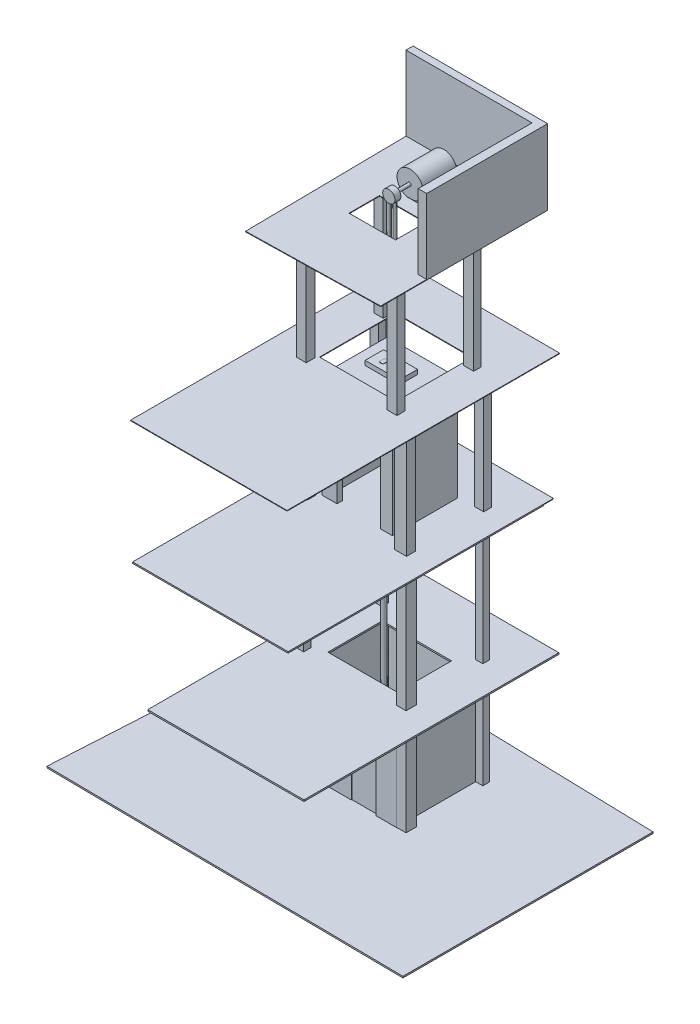
from build123d import *

# Parameters (mm, degrees)
BOSS_EXTRUDE1_DEPTH  = 10
SKETCH2_W            = 622.325209365
SKETCH2_H            = 576.276335175
SKETCH2_W_2          = 550.905616221
SKETCH2_H_2          = 495.653174758
BOSS_EXTRUDE2_DEPTH  = 700
BOSS_EXTRUDE3_DEPTH  = 10
SKETCH4_W            = 343.745663019
SKETCH4_H            = 631.457492732
CUT_EXTRUDE1_DEPTH   = 40
SKETCH5_W            = 96.085656893
SKETCH5_H            = 209.087602639
BOSS_EXTRUDE4_DEPTH  = 1
SKETCH6_W            = 75.527574186
SKETCH6_H            = 43.688329808
CUT_EXTRUDE2_DEPTH   = 1
SKETCH7_R            = 20.29708438
SKETCH7_R_2          = 20.231985555
BOSS_EXTRUDE5_DEPTH  = 1
BOSS_EXTRUDE6_DEPTH  = 1
SKETCH9_W            = 27.290112983
SKETCH9_H            = 631.457492732
BOSS_EXTRUDE7_DEPTH  = 170
SKETCH10_W           = 23.826275683
SKETCH10_H           = 630.503372623
BOSS_EXTRUDE8_DEPTH  = 170
SKETCH11_W           = 102.432085561
SKETCH11_H           = 42.683052162
BOSS_EXTRUDE9_DEPTH  = 1
SKETCH12_W           = 89.43349782
SKETCH12_H           = 33.905937228
CUT_EXTRUDE3_DEPTH   = 1
BOSS_EXTRUDE10_DEPTH = 1
BOSS_EXTRUDE11_DEPTH = 1
BOSS_EXTRUDE12_DEPTH = 1
SKETCH16_W           = 75.527574186
SKETCH16_H           = 43.688329808
CUT_EXTRUDE4_DEPTH   = 2
CUT_EXTRUDE5_DEPTH   = 1
SKETCH18_W           = 75.494640665
SKETCH18_H           = 38.009856791
CUT_EXTRUDE6_DEPTH   = 3
BOSS_EXTRUDE14_DEPTH = 2
BOSS_EXTRUDE15_DEPTH = 2
SKETCH21_W           = 58.041735581
SKETCH21_H           = 45.646263589
SKETCH21_W_2         = 54.653756563
SKETCH21_H_2         = 48.887872675
SKETCH21_W_3         = 63.825775254
SKETCH21_H_3         = 70.153711983
SKETCH21_W_4         = 48.378439297
SKETCH21_H_4         = 43.57114172
BOSS_EXTRUDE16_DEPTH = 1600
SKETCH22_W           = 465.641831392
SKETCH22_H           = 364.631720246
CUT_EXTRUDE7_DEPTH   = 70
SKETCH23_W           = 1044.065648516
SKETCH23_H           = 1716.075641176
BOSS_EXTRUDE18_DEPTH = 5
SKETCH24_W           = 472.771543007
SKETCH24_H           = 438.728357864
SKETCH24_W_2         = 404.318586856
SKETCH24_H_2         = 361.888448332
BOSS_EXTRUDE19_DEPTH = 700
SKETCH25_W           = 290.248609907
SKETCH25_H           = 638.909984856
CUT_EXTRUDE8_DEPTH   = 40
SKETCH26_W           = 59.689733019
SKETCH26_H           = 49.475646729
SKETCH26_W_2         = 79.466053006
SKETCH26_H_2         = 52.312288181
SKETCH26_W_3         = 60.325845498
SKETCH26_H_3         = 54.214911101
SKETCH26_W_4         = 80.955624427
SKETCH26_H_4         = 59.718140062
BOSS_EXTRUDE20_DEPTH = 800
SKETCH28_W           = 472.672569342
SKETCH28_H           = 438.728357864
BOSS_EXTRUDE21_DEPTH = 4
SKETCH29_W           = 228.446922655
SKETCH29_H           = 123.55099219
BOSS_EXTRUDE22_DEPTH = 30
SKETCH30_W           = 1044.065648516
SKETCH30_H           = 1782.700247623
BOSS_EXTRUDE23_DEPTH = 4
SKETCH31_W           = 1050.583005558
SKETCH31_H           = 1830.720434329
BOSS_EXTRUDE24_DEPTH = 4
SKETCH32_W           = 514.990058539
SKETCH32_H           = 511.804992363
CUT_EXTRUDE9_DEPTH   = 4
SKETCH33_W           = 63.367347411
SKETCH33_H           = 56.105555398
SKETCH33_H_2         = 60.314832869
SKETCH33_W_2         = 66.816738156
SKETCH33_H_3         = 52.847434566
SKETCH33_H_4         = 47.907719039
BOSS_EXTRUDE25_DEPTH = 800
SKETCH34_W           = 312.086622111
SKETCH34_H           = 204.425281741
BOSS_EXTRUDE26_DEPTH = 4
SKETCH35_W           = 111.938554272
SKETCH35_H           = 127.879547599
BOSS_EXTRUDE27_DEPTH = 30
SKETCH36_W           = 279.707395095
SKETCH36_H           = 227.391833538
BOSS_EXTRUDE28_DEPTH = 200
CUT_EXTRUDE12_DEPTH  = 300
SKETCH38_W           = 117.692937846
SKETCH38_H           = 291.677988516
BOSS_EXTRUDE30_DEPTH = 100
SKETCH39_R           = 10.828088903
BOSS_EXTRUDE31_DEPTH = 100
SKETCH40_R           = 41.018643384
BOSS_EXTRUDE32_DEPTH = 40
SKETCH41_W           = 27.446128015
SKETCH41_H           = 37.756844249
SKETCH41_W_2         = 24.781836282
BOSS_EXTRUDE33_DEPTH = 2
SKETCH44_R           = 11.467074447
SKETCH46_R           = 9.823580294
SKETCH47_W           = 623.306331777
SKETCH47_H           = 570.678580882
SKETCH47_W_2         = 549.828955375
SKETCH47_H_2         = 462.441804075
BOSS_EXTRUDE34_DEPTH = 300
SKETCH48_W           = 514.95697195
SKETCH48_H           = 266.339325906
CUT_EXTRUDE13_DEPTH  = 60
SKETCH49_W           = 622.859090635
SKETCH49_H           = 570.69260873
BOSS_EXTRUDE35_DEPTH = 70
SKETCH50_W           = 196.360429418
SKETCH50_H           = 269.298826678
BOSS_EXTRUDE36_DEPTH = 50
BOSS_EXTRUDE37_DEPTH = 800
SKETCH52_R           = 16.098358844
BOSS_EXTRUDE38_DEPTH = 500


with BuildPart() as part:
    # Sketch1 → Boss-Extrude1 (new body)
    with BuildSketch(Plane(origin=(0, 0, 0), x_dir=(1, 0, 0), z_dir=(0, 1, 0))):
        Polygon((-1119.518495779, 584.225591226), (1199.119390028, 522.766452142), (1199.119390028, -1157.176571965), (-1218.045061075, -1131.023727215), align=None)
    extrude(amount=BOSS_EXTRUDE1_DEPTH)

    # Sketch2 → Boss-Extrude2 (add)
    with BuildSketch(Plane(origin=(0, 10, 0), x_dir=(1, 0, 0), z_dir=(0, 1, 0))):
        with Locations((0.175057265, -25.815388539)):
            Rectangle(SKETCH2_W, SKETCH2_H)
        with Locations((3.438260109, -29.815460152)):
            Rectangle(SKETCH2_W_2, SKETCH2_H_2, mode=Mode.SUBTRACT)
    extrude(amount=BOSS_EXTRUDE2_DEPTH)

    # Sketch3 → Boss-Extrude3 (add)
    with BuildSketch(Plane(origin=(0, 710, 0), x_dir=(1, 0, 0), z_dir=(0, 1, 0))):
        Polygon((-498.57587171, 538.560257436), (550.684656158, 538.560257436), (550.684656158, -1173.440998756), (-498.57587171, -1173.185548573), align=None)
    extrude(amount=BOSS_EXTRUDE3_DEPTH)

    # Sketch4 → Cut-Extrude1 (cut)
    with BuildSketch(Plane.XY.offset(313.953556126)):
        with Locations((1.971257292, 325.728746366)):
            Rectangle(SKETCH4_W, SKETCH4_H)
    extrude(amount=-CUT_EXTRUDE1_DEPTH, mode=Mode.SUBTRACT)

    # Sketch5 → Boss-Extrude4 (add)
    with BuildSketch(Plane.XY.offset(313.953556126)):
        with Locations((-235.628465158, 369.989290471)):
            Rectangle(SKETCH5_W, SKETCH5_H)
    extrude(amount=BOSS_EXTRUDE4_DEPTH)

    # Sketch6 → Cut-Extrude2 (cut)
    with BuildSketch(Plane.XY.offset(314.953556126)):
        with Locations((-233.410831007, 396.905866965)):
            Rectangle(SKETCH6_W, SKETCH6_H)
    extrude(amount=-CUT_EXTRUDE2_DEPTH, mode=Mode.SUBTRACT)

    # Sketch7 → Boss-Extrude5 (add)
    with BuildSketch(Plane.XY.offset(314.953556126)):
        with Locations((-236.075713016, 343.617219623)):
            Circle(SKETCH7_R)
        with Locations((-236.075713016, 291.501520139)):
            Circle(SKETCH7_R_2)
    extrude(amount=BOSS_EXTRUDE5_DEPTH)

    # Sketch8 → Boss-Extrude6 (add)
    with BuildSketch(Plane.XY.offset(315.953556126)):
        Polygon((-248.100542069, 334.343180385), (-224.116847865, 334.343180385), (-236.108694967, 356.570085863), align=None)
        Polygon((-248.100542069, 300.734143469), (-224.116847865, 300.734143469), (-236.108694967, 278.021129489), align=None)
    extrude(amount=BOSS_EXTRUDE6_DEPTH)

    # Sketch9 → Boss-Extrude7 (add)
    with BuildSketch(Plane(origin=(-169.901574217, 0, 0), x_dir=(0, 0, -1), z_dir=(1, 0, 0))):
        with Locations((-291.287104022, 325.728746366)):
            Rectangle(SKETCH9_W, SKETCH9_H)
    extrude(amount=BOSS_EXTRUDE7_DEPTH)

    # Sketch10 → Boss-Extrude8 (add)
    with BuildSketch(Plane(origin=(0.098425783, 0, 0), x_dir=(0, 0, -1), z_dir=(1, 0, 0))):
        with Locations((-289.555185372, 325.251686312)):
            Rectangle(SKETCH10_W, SKETCH10_H)
    extrude(amount=BOSS_EXTRUDE8_DEPTH)

    # Sketch11 → Boss-Extrude9 (add)
    with BuildSketch(Plane.XY.offset(313.953556126)):
        with Locations((-2.491684156, 672.586316149)):
            Rectangle(SKETCH11_W, SKETCH11_H)
    extrude(amount=BOSS_EXTRUDE9_DEPTH)

    # Sketch12 → Cut-Extrude3 (cut)
    with BuildSketch(Plane.XY.offset(314.953556126)):
        with Locations((-2.82995258, 672.168915251)):
            Rectangle(SKETCH12_W, SKETCH12_H)
    extrude(amount=-CUT_EXTRUDE3_DEPTH, mode=Mode.SUBTRACT)

    # Sketch13 → Boss-Extrude10 (add)
    with BuildSketch(Plane.XY.offset(313.953556126)):
        Polygon((-16.188659158, 682.333537789), (-12.363636267, 682.333537789), (-16.280886962, 666.180161515), (-10.826136902, 666.180161515), (-10.826136902, 671.523280071), (-7.909927509, 671.523280071), (-7.909927509, 666.180161515), (-5.371386842, 666.180161515), (-5.371386842, 662.797245592), (-7.909927509, 662.797245592), (-7.909927509, 659.936990738), (-10.826136902, 659.936990738), (-10.826136902, 662.797245592), (-21.28940391, 662.797245592), align=None)
    extrude(amount=BOSS_EXTRUDE10_DEPTH)

    # Sketch14 → Boss-Extrude11 (add)
    with BuildSketch(Plane.XY.offset(313.953556126)):
        Polygon((8.28251296, 678.526064939), (25.453577984, 678.526064939), (16.868045472, 660.40217423), align=None)
    extrude(amount=BOSS_EXTRUDE11_DEPTH)

    # Sketch15 → Boss-Extrude12 (add)
    with BuildSketch(Plane.XY.offset(313.953556126)):
        Polygon((-253.392365097, 406.408287302), (-253.392365097, 387.565087067), (-258.932297981, 387.565087067), (-258.932297981, 385.030446751), (-244.376138332, 385.030446751), (-244.376138332, 387.568096861), (-249.880180429, 387.568096861), (-249.880180429, 410.563051887), (-259.692933011, 410.252172121), (-259.566620724, 406.408287302), align=None)
    extrude(amount=BOSS_EXTRUDE12_DEPTH)

    # Sketch16 → Cut-Extrude4 (cut)
    with BuildSketch(Plane.XY.offset(313.953556126)):
        with Locations((-233.410831007, 396.905866965)):
            Rectangle(SKETCH16_W, SKETCH16_H)
        Polygon((-258.932297981, 387.565087067), (-253.392365097, 387.565087067), (-253.392365097, 406.408287302), (-259.566620724, 406.408287302), (-259.692933011, 410.252172121), (-249.880180429, 410.563051887), (-249.880180429, 387.568096861), (-244.376138332, 387.568096861), (-244.376138332, 385.030446751), (-258.932297981, 385.030446751), align=None, mode=Mode.SUBTRACT)
        with BuildLine():
            Line((-235.648545177, 385.585769087), (-235.648545177, 408.465773981))
            Line((-235.648545177, 408.465773981), (-231.895053527, 408.465773981))
            Line((-231.895053527, 408.465773981), (-231.895053527, 406.607783771))
            ThreePointArc((-231.895053527, 406.607783771), (-226.013052079, 408.340663022), (-220.604725505, 405.450885314))
            ThreePointArc((-220.604725505, 405.450885314), (-212.450287881, 408.121471894), (-206.512581436, 401.927077024))
            Line((-206.512581436, 401.927077024), (-206.270978925, 385.585769087))
            Line((-206.270978925, 385.585769087), (-208.886279481, 385.585769087))
            Line((-208.886279481, 385.585769087), (-208.886279481, 401.591739947))
            ThreePointArc((-208.886279481, 401.591739947), (-213.544522639, 405.905815865), (-219.282803566, 403.188719557))
            Line((-219.282803566, 403.188719557), (-219.086260967, 397.970062451))
            Line((-219.086260967, 397.970062451), (-218.821188952, 385.585769087))
            Line((-218.821188952, 385.585769087), (-221.983422689, 385.585769087))
            Line((-221.983422689, 385.585769087), (-221.983422689, 403.056833873))
            ThreePointArc((-221.983422689, 403.056833873), (-227.433038153, 405.693579889), (-232.223072214, 401.991376226))
            Line((-232.223072214, 401.991376226), (-232.106265572, 385.585769087))
            Line((-232.106265572, 385.585769087), (-235.648545177, 385.585769087))
        make_face(mode=Mode.SUBTRACT)
    extrude(amount=-CUT_EXTRUDE4_DEPTH, mode=Mode.SUBTRACT)

    # Sketch17 → Cut-Extrude5 (cut)
    with BuildSketch(Plane.XY.offset(311.953556126)):
        Polygon((-271.209439503, 458.857228745), (-195.647043914, 458.857228745), (-195.704078741, 418.44137546), (-271.209439503, 418.44137546), align=None)
    extrude(amount=-CUT_EXTRUDE5_DEPTH, mode=Mode.SUBTRACT)

    # Sketch18 → Cut-Extrude6 (cut)
    with BuildSketch(Plane.XY.offset(314.953556126)):
        with Locations((-233.394364247, 437.754960265)):
            Rectangle(SKETCH18_W, SKETCH18_H)
    extrude(amount=-CUT_EXTRUDE6_DEPTH, mode=Mode.SUBTRACT)

    # Sketch19 → Boss-Extrude14 (add)
    with BuildSketch(Plane.XY.offset(310.953556126)):
        Polygon((-254.312852224, 446.740647117), (-254.312852224, 426.35566573), (-259.396180858, 426.35566573), (-259.396180858, 423.275008449), (-244.678284124, 423.275008449), (-244.678284124, 426.345347073), (-250.728067912, 426.345347073), (-250.728067912, 450.11543046), (-259.396180858, 450.11543046), (-259.396180858, 446.740647117), align=None)
    extrude(amount=BOSS_EXTRUDE14_DEPTH)

    # Sketch20 → Boss-Extrude15 (add)
    with BuildSketch(Plane.XY.offset(310.953556126)):
        with BuildLine():
            Line((-231.738910846, 449.836701393), (-231.738910846, 423.361516406))
            Line((-231.738910846, 423.361516406), (-228.297984767, 423.361516406))
            Line((-228.297984767, 423.361516406), (-228.145561752, 436.327846212))
            ThreePointArc((-228.145561752, 436.327846212), (-216.928259639, 443.252630869), (-228.56606882, 449.444715067))
            Line((-228.56606882, 449.444715067), (-228.61564163, 450.293665645))
            Line((-228.61564163, 450.293665645), (-231.738910846, 450.293665645))
            Line((-231.738910846, 450.293665645), (-231.738910846, 449.836701393))
        make_face()
        with BuildLine():
            Line((-228.56606882, 446.492870427), (-228.297984767, 439.236609845))
            ThreePointArc((-228.297984767, 439.236609845), (-219.191503534, 443.206133185), (-228.56606882, 446.492870427))
        make_face(mode=Mode.SUBTRACT)
    extrude(amount=BOSS_EXTRUDE15_DEPTH)

    # Sketch21 → Boss-Extrude16 (add)
    with BuildSketch(Plane(origin=(0, 10, 0), x_dir=(1, 0, 0), z_dir=(0, 1, 0))):
        with Locations((-341.228646018, 235.659694827)):
            Rectangle(SKETCH21_W, SKETCH21_H)
        with Locations((-338.314425699, -289.509619789)):
            Rectangle(SKETCH21_W_2, SKETCH21_H_2)
        with Locations((343.449473115, -277.469052902)):
            Rectangle(SKETCH21_W_3, SKETCH21_H_3)
        with Locations((335.526881597, 240.537208189)):
            Rectangle(SKETCH21_W_4, SKETCH21_H_4)
    extrude(amount=BOSS_EXTRUDE16_DEPTH)

    # Sketch22 → Cut-Extrude7 (cut)
    with BuildSketch(Plane(origin=(0, 720, 0), x_dir=(1, 0, 0), z_dir=(0, 1, 0))):
        with Locations((5.017295511, -51.54680296)):
            Rectangle(SKETCH22_W, SKETCH22_H)
    extrude(amount=-CUT_EXTRUDE7_DEPTH, mode=Mode.SUBTRACT)

    # Sketch23 → Boss-Extrude18 (add)
    with BuildSketch(Plane(origin=(0, 1610, 0), x_dir=(1, 0, 0), z_dir=(0, 1, 0))):
        with Locations((12.155944641, -405.855425018)):
            Rectangle(SKETCH23_W, SKETCH23_H)
    extrude(amount=BOSS_EXTRUDE18_DEPTH)

    # Sketch24 → Boss-Extrude19 (add)
    with BuildSketch(Plane(origin=(0, 1615, 0), x_dir=(1, 0, 0), z_dir=(0, 1, 0))):
        with Locations((-26.550057393, -19.91757462)):
            Rectangle(SKETCH24_W, SKETCH24_H)
        with Locations((-34.811128211, -22.964240496)):
            Rectangle(SKETCH24_W_2, SKETCH24_H_2, mode=Mode.SUBTRACT)
    extrude(amount=BOSS_EXTRUDE19_DEPTH)

    # Sketch25 → Cut-Extrude8 (cut)
    with BuildSketch(Plane.XY.offset(239.281753552)):
        with Locations((-16.228275909, 1934.454992428)):
            Rectangle(SKETCH25_W, SKETCH25_H)
    extrude(amount=-CUT_EXTRUDE8_DEPTH, mode=Mode.SUBTRACT)

    # Sketch26 → Boss-Extrude20 (add)
    with BuildSketch(Plane(origin=(0, 1615, 0), x_dir=(1, 0, 0), z_dir=(0, 1, 0))):
        with Locations((-362.18795287, 236.087098167)):
            Rectangle(SKETCH26_W, SKETCH26_H)
        with Locations((-322.454926366, -288.258242075)):
            Rectangle(SKETCH26_W_2, SKETCH26_H_2)
        with Locations((347.582849239, 233.422104066)):
            Rectangle(SKETCH26_W_3, SKETCH26_H_3)
        with Locations((337.267959775, -282.185245591)):
            Rectangle(SKETCH26_W_4, SKETCH26_H_4)
    extrude(amount=BOSS_EXTRUDE20_DEPTH)

    # Sketch28 → Boss-Extrude21 (add)
    with BuildSketch(Plane(origin=(0, 2315, 0), x_dir=(1, 0, 0), z_dir=(0, 1, 0))):
        with Locations((-26.570026865, -19.91757462)):
            Rectangle(SKETCH28_W, SKETCH28_H)
    extrude(amount=BOSS_EXTRUDE21_DEPTH)

    # Sketch29 → Boss-Extrude22 (add)
    with BuildSketch(Plane(origin=(0, 2319, 0), x_dir=(1, 0, 0), z_dir=(0, 1, 0))):
        with Locations((-57.096223776, 21.119776465)):
            Rectangle(SKETCH29_W, SKETCH29_H)
    extrude(amount=BOSS_EXTRUDE22_DEPTH)

    # Sketch30 → Boss-Extrude23 (add)
    with BuildSketch(Plane(origin=(0, 1615, 0), x_dir=(1, 0, 0), z_dir=(0, 1, 0))):
        with Locations((12.155944641, -372.543121795)):
            Rectangle(SKETCH30_W, SKETCH30_H)
    extrude(amount=BOSS_EXTRUDE23_DEPTH)

    # Sketch31 → Boss-Extrude24 (add)
    with BuildSketch(Plane(origin=(0, 2415, 0), x_dir=(1, 0, 0), z_dir=(0, 1, 0))):
        with Locations((-15.788561063, -330.533035321)):
            Rectangle(SKETCH31_W, SKETCH31_H)
    extrude(amount=BOSS_EXTRUDE24_DEPTH)

    # Sketch32 → Cut-Extrude9 (cut)
    with BuildSketch(Plane(origin=(0, 2419, 0), x_dir=(1, 0, 0), z_dir=(0, 1, 0))):
        with Locations((-15.781275819, 11.28944274)):
            Rectangle(SKETCH32_W, SKETCH32_H)
    extrude(amount=-CUT_EXTRUDE9_DEPTH, mode=Mode.SUBTRACT)

    # Sketch33 → Boss-Extrude25 (add)
    with BuildSketch(Plane(origin=(0, 2419, 0), x_dir=(1, 0, 0), z_dir=(0, 1, 0))):
        with Locations((-316.709024345, 222.68762458)):
            Rectangle(SKETCH33_W, SKETCH33_H)
        with Locations((-316.709024345, -292.724283335)):
            Rectangle(SKETCH33_W, SKETCH33_H_2)
        with Locations((293.409416414, -298.493544952)):
            Rectangle(SKETCH33_W_2, SKETCH33_H_3)
        with Locations((293.409416414, 214.129268769)):
            Rectangle(SKETCH33_W_2, SKETCH33_H_4)
    extrude(amount=BOSS_EXTRUDE25_DEPTH)

    # Sketch34 → Boss-Extrude26 (add)
    with BuildSketch(Plane(origin=(0, 3219, 0), x_dir=(1, 0, 0), z_dir=(0, 1, 0))):
        Polygon((438.893469042, 574.738573391), (-464.628874936, 574.738573391), (-449.624556892, -565.264865707), (438.893469042, -546.439599472), align=None)
        with Locations((-51.429821055, -10.284957)):
            Rectangle(SKETCH34_W, SKETCH34_H, mode=Mode.SUBTRACT)
    extrude(amount=BOSS_EXTRUDE26_DEPTH)

    # Sketch35 → Boss-Extrude27 (add)
    with BuildSketch(Plane(origin=(0, 3223, 0), x_dir=(1, 0, 0), z_dir=(0, 1, 0))):
        with Locations((-55.969277136, 240.974060897)):
            Rectangle(SKETCH35_W, SKETCH35_H)
    extrude(amount=BOSS_EXTRUDE27_DEPTH)

    # Sketch36 → Boss-Extrude28 (add)
    with BuildSketch(Plane(origin=(0, 3253, 0), x_dir=(1, 0, 0), z_dir=(0, 1, 0))):
        with Locations((-58.018918374, 261.951392482)):
            Rectangle(SKETCH36_W, SKETCH36_H)
    extrude(amount=BOSS_EXTRUDE28_DEPTH)

    # Sketch37 → Cut-Extrude12 (cut)
    with BuildSketch(Plane.XY.offset(-148.255475713)):
        with BuildLine():
            Line((-36.513660596, 3251.837379956), (81.834779174, 3251.491552197))
            Line((81.834779174, 3251.491552197), (81.834779174, 3453))
            Line((81.834779174, 3453), (-197.872615921, 3453))
            Line((-197.872615921, 3453), (-197.872615921, 3252.308889391))
            Line((-197.872615921, 3252.308889391), (-80.943925959, 3251.967210304))
            ThreePointArc((-80.943925959, 3251.967210304), (-58.226698877, 3423.727972341), (-36.513660596, 3251.837379956))
        make_face()
    extrude(amount=-CUT_EXTRUDE12_DEPTH, mode=Mode.SUBTRACT)

    # Sketch38 → Boss-Extrude30 (add)
    with BuildSketch(Plane(origin=(0, 3223, 0), x_dir=(1, 0, 0), z_dir=(0, 1, 0))):
        with Locations((141.222924039, 291.965818935)):
            Rectangle(SKETCH38_W, SKETCH38_H)
    extrude(amount=BOSS_EXTRUDE30_DEPTH)

    # Sketch39 → Boss-Extrude31 (add)
    with BuildSketch(Plane.XY.offset(-148.255475713)):
        with Locations(Location((-61.625784042, 3334.571892159, 0), (0, 0, 180))):
            Circle(SKETCH39_R)
    extrude(amount=BOSS_EXTRUDE31_DEPTH)

    # Sketch40 → Boss-Extrude32 (add)
    with BuildSketch(Plane.XY.offset(-48.255475713)):
        with Locations((-61.237530516, 3333.515347994)):
            Circle(SKETCH40_R)
    extrude(amount=BOSS_EXTRUDE32_DEPTH)

    # Sketch41 → Boss-Extrude33 (add)
    with BuildSketch(Plane(origin=(0, 2349, 0), x_dir=(1, 0, 0), z_dir=(0, 1, 0))):
        with Locations((-101.792050733, 14.948680038)):
            Rectangle(SKETCH41_W, SKETCH41_H)
        with Locations((9.217155089, 14.948680038)):
            Rectangle(SKETCH41_W_2, SKETCH41_H)
    extrude(amount=BOSS_EXTRUDE33_DEPTH)

    # Sweep2: sweep along a curve in space
    with BuildLine() as sweep2_path:
        Line((-69.818676956, 2349, -25.14068985), (-79.185210588, 3344.674561059, -25.14068985))
    # Sketch44 → Sweep2 (sweep)
    with BuildSketch(Plane(origin=(0, 2349, 0), x_dir=(1, 0, 0), z_dir=(0, 1, 0))):
        with Locations((-69.818676956, 25.14068985)):
            Circle(SKETCH44_R)
    sweep(path=sweep2_path.line)

    # Sweep3: sweep along a curve in space
    with BuildLine() as sweep3_path:
        Line((-25.06985845, 2349, -26.133194889), (-39.649239442, 3323.467405095, -26.133194889))
    # Sketch46 → Sweep3 (sweep)
    with BuildSketch(Plane(origin=(0, 2349, 0), x_dir=(1, 0, 0), z_dir=(0, 1, 0))):
        with Locations((-25.06985845, 26.133194889)):
            Circle(SKETCH46_R)
    sweep(path=sweep3_path.line)

    # Sketch47 → Boss-Extrude34 (add)
    with BuildSketch(Plane(origin=(0, 0, 0), x_dir=(-1, 0, 0), z_dir=(0, -1, 0))):
        with Locations((-3.809117878, -114.011349818)):
            Rectangle(SKETCH47_W, SKETCH47_H)
        with Locations((9.185733485, -117.983065203)):
            Rectangle(SKETCH47_W_2, SKETCH47_H_2, mode=Mode.SUBTRACT)
    extrude(amount=BOSS_EXTRUDE34_DEPTH)

    # Sketch48 → Cut-Extrude13 (cut)
    with BuildSketch(Plane.XY.offset(399.350640259)):
        with Locations((4.540089723, -166.830337047)):
            Rectangle(SKETCH48_W, SKETCH48_H)
    extrude(amount=-CUT_EXTRUDE13_DEPTH, mode=Mode.SUBTRACT)

    # Sketch49 → Boss-Extrude35 (add)
    with BuildSketch(Plane(origin=(0, -300, 0), x_dir=(-1, 0, 0), z_dir=(0, -1, 0))):
        with Locations((-4.032738448, -114.018363742)):
            Rectangle(SKETCH49_W, SKETCH49_H)
    extrude(amount=BOSS_EXTRUDE35_DEPTH)

    # Sketch50 → Boss-Extrude36 (add)
    with BuildSketch(Plane(origin=(0, -300, 0), x_dir=(1, 0, 0), z_dir=(0, 1, 0))):
        with Locations((-4.59433776, -88.988029308)):
            Rectangle(SKETCH50_W, SKETCH50_H)
    extrude(amount=BOSS_EXTRUDE36_DEPTH)

    # Sketch51 → Boss-Extrude37 (add)
    with BuildSketch(Plane.XY.offset(399.364668107)):
        Polygon((-299.714093384, -334.821602908), (-514.692066237, -498.895904293), (537.081404738, -490.322929457), (286.721272943, -326.139668199), align=None)
    extrude(amount=-BOSS_EXTRUDE37_DEPTH)

    # Sweep5: sweep along a curve in space
    with BuildLine() as sweep5_path:
        Line((-12.15661723, -250, 71.277917619), (-18.095728644, 1594.450854375, 71.277917619))
    # Sketch52 → Sweep5 (sweep)
    with BuildSketch(Plane(origin=(0, -250, 0), x_dir=(1, 0, 0), z_dir=(0, 1, 0))):
        with Locations((-12.15661723, -71.277917619)):
            Circle(SKETCH52_R)
    sweep(path=sweep5_path.line)

    # Sketch53 → Boss-Extrude38 (add)
    with BuildSketch(Plane(origin=(0, 3223, 0), x_dir=(1, 0, 0), z_dir=(0, 1, 0))):
        Polygon((-464.628874936, 574.738573391), (438.893469042, 574.738573391), (438.893469042, -237.471841162), (382.185953865, -237.471841162), (382.185953865, 527.029232239), (-464.628874936, 527.029232239), align=None)
    extrude(amount=BOSS_EXTRUDE38_DEPTH)


solid = part.part
